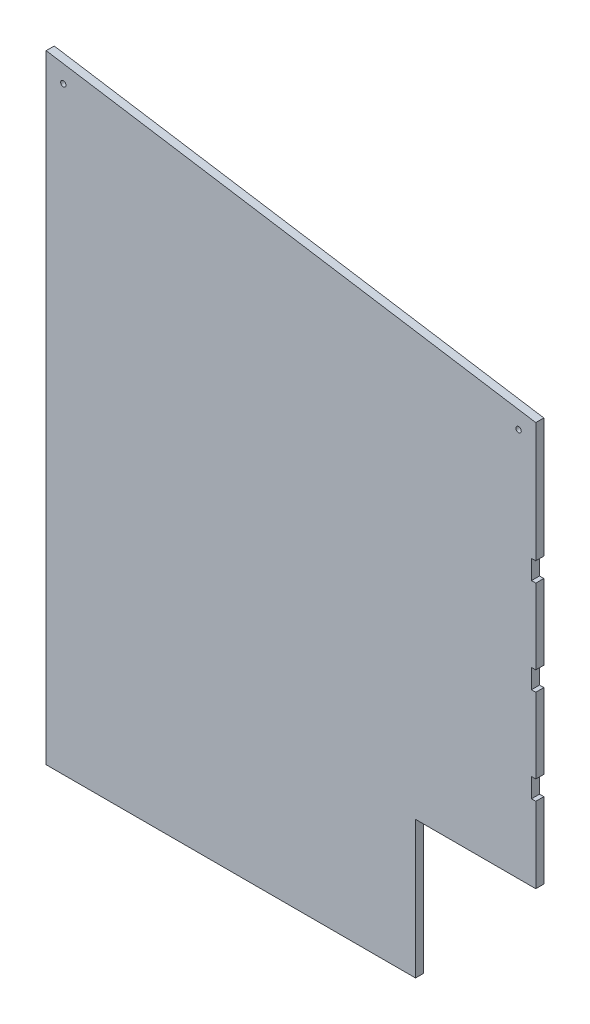
from build123d import *

# Parameters (mm, degrees)
BOSS_EXTRUDE1_DEPTH            = 11.90625
SKETCH2_W                      = 6.35
SKETCH2_H                      = 28.575
CUT_EXTRUDE1_DEPTH             = 776.954747608
F_5_16_0_3125_DIAMETER_HOLE1_D = 7.9375


with BuildPart() as part:
    # Sketch1 → Boss-Extrude1 (new body)
    with BuildSketch(Plane.XY):
        Polygon((-232.571060311, 313.933610791), (-232.571060311, -600.466389209), (313.528939689, -600.466389209), (313.528939689, -397.266389209), (491.328939689, -397.266389209), (491.328939689, 199.633610791), align=None)
    extrude(amount=BOSS_EXTRUDE1_DEPTH)

    # Sketch2 → Cut-Extrude1 (cut, through all)
    with BuildSketch(Plane.XY.offset(11.90625)):
        with Locations((488.153939689, -271.028389209)):
            Rectangle(SKETCH2_W, SKETCH2_H)
        with Locations((488.153939689, -131.328389209)):
            Rectangle(SKETCH2_W, SKETCH2_H)
        with Locations((488.153939689, 8.371610791)):
            Rectangle(SKETCH2_W, SKETCH2_H)
    extrude(amount=-CUT_EXTRUDE1_DEPTH, mode=Mode.SUBTRACT)

    # 5/16 (0.3125) Diameter Hole1 (through all)
    with Locations(Plane(origin=(0, 0, 0), x_dir=(-1, 0, 0), z_dir=(0, 0, -1))):
        with Locations((207.171060311, 284.20841315), (-465.928939689, 177.929465782)):
            Hole(F_5_16_0_3125_DIAMETER_HOLE1_D / 2)


solid = part.part
